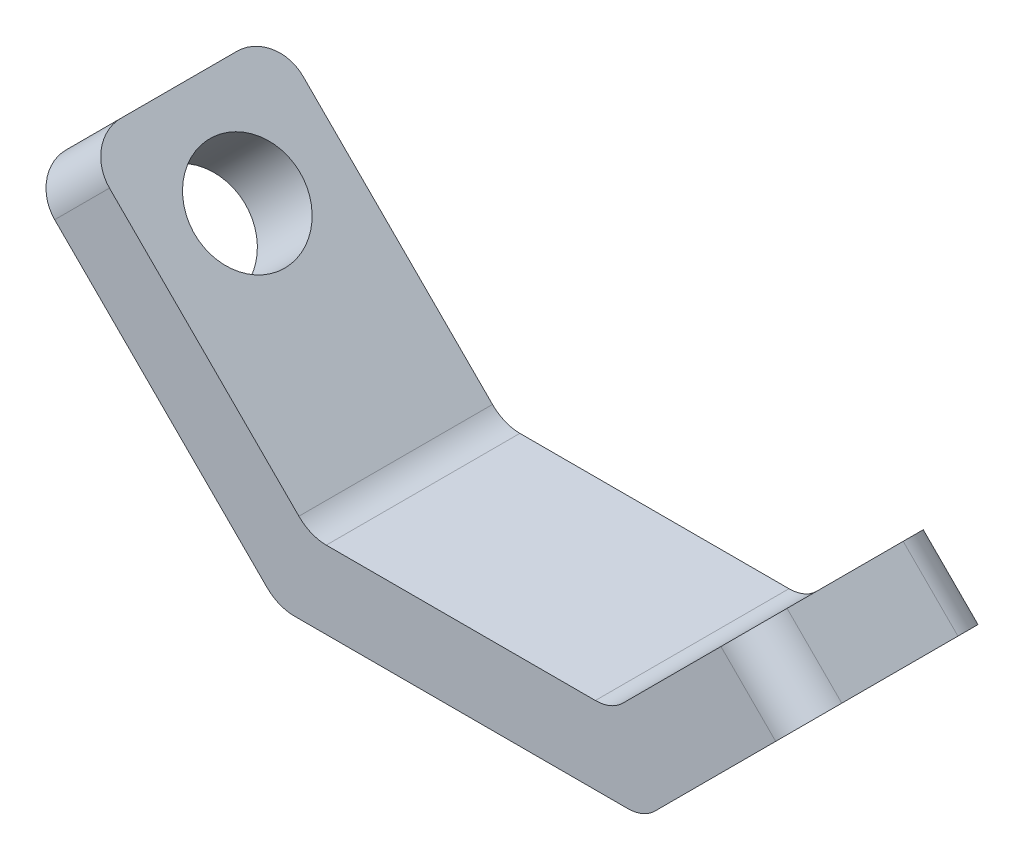
from build123d import *

# Parameters (mm, degrees)
EXTRUDE_1_DEPTH          = 7.5
CUT_EXTRUDE_1_DEPTH      = 48.653472734
CUT_EXTRUDE_1_DEPTH_BACK = 48.653472734
SKETCH_2_R               = 4.1
CUT_EXTRUDE_2_DEPTH      = 52.14195929
CUT_EXTRUDE_2_DEPTH_BACK = 52.14195929
SKETCH_3_R               = 4.1
FILLET_1_R               = 3


with BuildPart() as part:
    # ｽｹｯﾁ1 → ﾎﾞｽ - 押し出し1 (new, symmetric)
    with BuildSketch(Plane.XY):
        Polygon((0, 0), (-19.435028843, 19.435028843), (-15.192388155, 23.67766953), (2.485281374, 6), (25.819805153, 6), (36.426406871, 16.606601718), (40.669047558, 12.363961031), (28.305086528, 0), align=None)
    extrude(amount=EXTRUDE_1_DEPTH, both=True)

    # ｽｹｯﾁ2 → ｶｯﾄ - 押し出し1 (cut, two sides: drawn at the far end of the back side and taken through both)
    with BuildSketch(Plane(origin=(0, 0, 0), x_dir=(0, 0, 1), z_dir=(-0.7071067811865487, -0.7071067811865464, 0)).offset(-CUT_EXTRUDE_1_DEPTH_BACK)):
        with Locations((0, 19.985281374)):
            Circle(SKETCH_2_R)
    extrude(amount=CUT_EXTRUDE_1_DEPTH + CUT_EXTRUDE_1_DEPTH_BACK, mode=Mode.SUBTRACT)

    # ｽｹｯﾁ3 → ｶｯﾄ - 押し出し2 (cut, two sides: drawn at the far end of the back side and taken through both)
    with BuildSketch(Plane(origin=(14.152543264, -14.152543264, 0), x_dir=(0, 0, -1), z_dir=(0.707106781186549, -0.7071067811865461, 0)).offset(-CUT_EXTRUDE_2_DEPTH_BACK)):
        with Locations((0, 30)):
            Circle(SKETCH_3_R)
    extrude(amount=CUT_EXTRUDE_2_DEPTH + CUT_EXTRUDE_2_DEPTH_BACK, mode=Mode.SUBTRACT)

    # ﾌｨﾚｯﾄ1
    fillet_1_edges = [part.edges().sort_by_distance(p)[0] for p in [
        (38.547727215, 14.485281374, -7.5),
        (38.547727215, 14.485281374, 7.5),
        (-17.313708499, 21.556349186, -7.5),
        (-17.313708499, 21.556349186, 7.5),
        (28.305086528, 0, 0),
        (0, 0, 0),
        (25.819805153, 6, 0),
        (2.485281374, 6, 0),
    ]]
    fillet(fillet_1_edges, radius=FILLET_1_R)


solid = part.part
